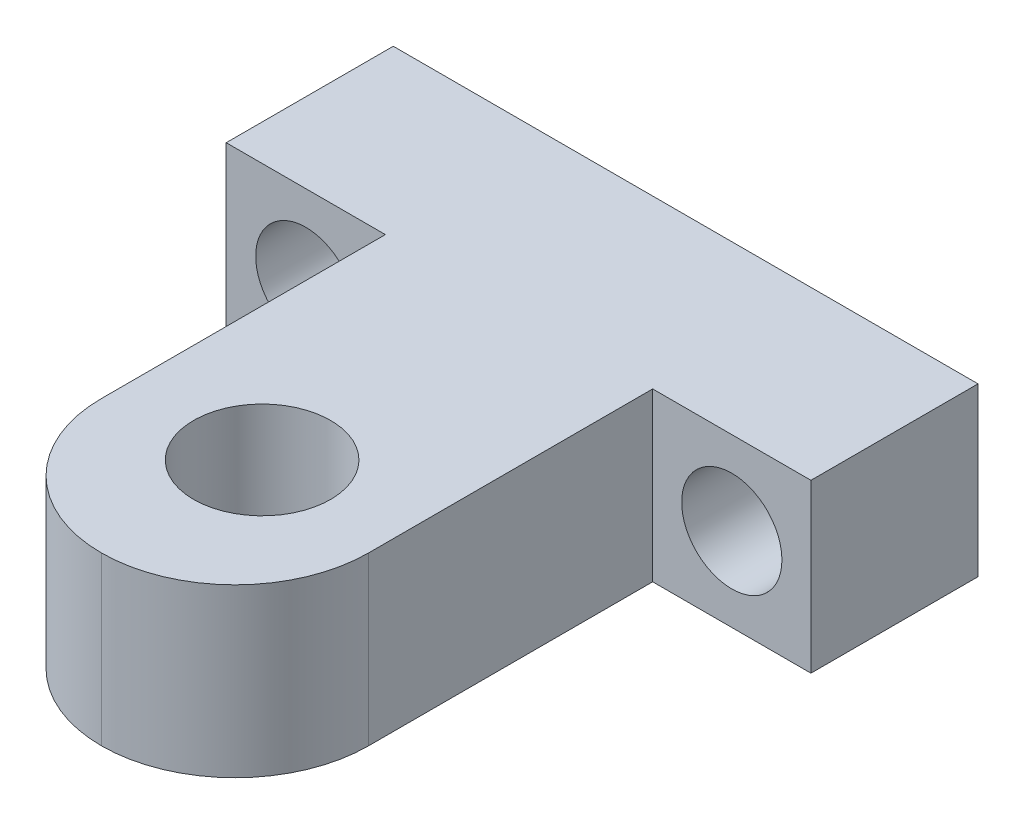
from build123d import *

# Parameters (mm, degrees)
SKETCH1_W           = 35
SKETCH1_H           = 10
BOSS_EXTRUDE1_DEPTH = 10
SKETCH2_W           = 16
SKETCH2_H           = 10
BOSS_EXTRUDE2_DEPTH = 25
CUT_EXTRUDE3_START  = -7.959741
SKETCH3_R           = 4.1
CUT_EXTRUDE3_DEPTH  = 7.959741
SKETCH4_R           = 1.7
CUT_EXTRUDE4_DEPTH  = 13
SKETCH5_R           = 3
SKETCH5_R_2         = 1.7
CUT_EXTRUDE5_DEPTH  = 6
FILLET1_R           = 8


with BuildPart() as part:
    # Sketch1 → Boss-Extrude1 (new body)
    with BuildSketch(Plane.XY.offset(315.507646495)):
        with Locations((-0.05341426, 5.6352577)):
            Rectangle(SKETCH1_W, SKETCH1_H)
    extrude(amount=BOSS_EXTRUDE1_DEPTH)

    # Sketch2 → Boss-Extrude2 (add)
    with BuildSketch(Plane.XY.offset(325.507646495)):
        with Locations((-0.02670713, 5.6352577)):
            Rectangle(SKETCH2_W, SKETCH2_H)
    extrude(amount=BOSS_EXTRUDE2_DEPTH)

    # Sketch3 → Cut-Extrude3 (cut)
    with BuildSketch(Plane(origin=(0, 10.6352577, 0), x_dir=(1, 0, 0), z_dir=(0, 1, 0)).offset(CUT_EXTRUDE3_START)):
        with Locations(Location((-0.034055406, -340.877646495, 0), (0, 0, 270))):
            Circle(SKETCH3_R)
    extrude(amount=CUT_EXTRUDE3_DEPTH, mode=Mode.SUBTRACT)

    # Sketch4 → Cut-Extrude4 (cut)
    with BuildSketch(Plane.XY.offset(325.507646495)):
        with Locations((-12.790060695, 5.6352577)):
            Circle(SKETCH4_R)
        with Locations((12.709939305, 5.6352577)):
            Circle(SKETCH4_R)
    extrude(amount=-CUT_EXTRUDE4_DEPTH, mode=Mode.SUBTRACT)

    # Sketch5 → Cut-Extrude5 (cut)
    # profile 1 of 2: a face of its own
    with BuildSketch(Plane.XY.offset(325.507646495)):
        with Locations((-12.790060695, 5.6352577)):
            Circle(SKETCH5_R)
        with Locations((-12.790060695, 5.6352577)):
            Circle(SKETCH5_R_2, mode=Mode.SUBTRACT)
    # profile 2 of 2: a face of its own
    with BuildSketch(Plane.XY.offset(325.507646495)):
        with Locations((12.709939305, 5.6352577)):
            Circle(SKETCH5_R)
        with Locations((12.709939305, 5.6352577)):
            Circle(SKETCH5_R_2, mode=Mode.SUBTRACT)
    extrude(amount=-CUT_EXTRUDE5_DEPTH, mode=Mode.SUBTRACT)

    # Fillet1
    fillet1_edges = [part.edges().sort_by_distance(p)[0] for p in [
        (7.97329287, 5.6352577, 350.507646495),
        (-8.02670713, 5.6352577, 350.507646495),
    ]]
    fillet(fillet1_edges, radius=FILLET1_R - 0.0001)  # a hair under: the kernel refuses the full size


solid = part.part
